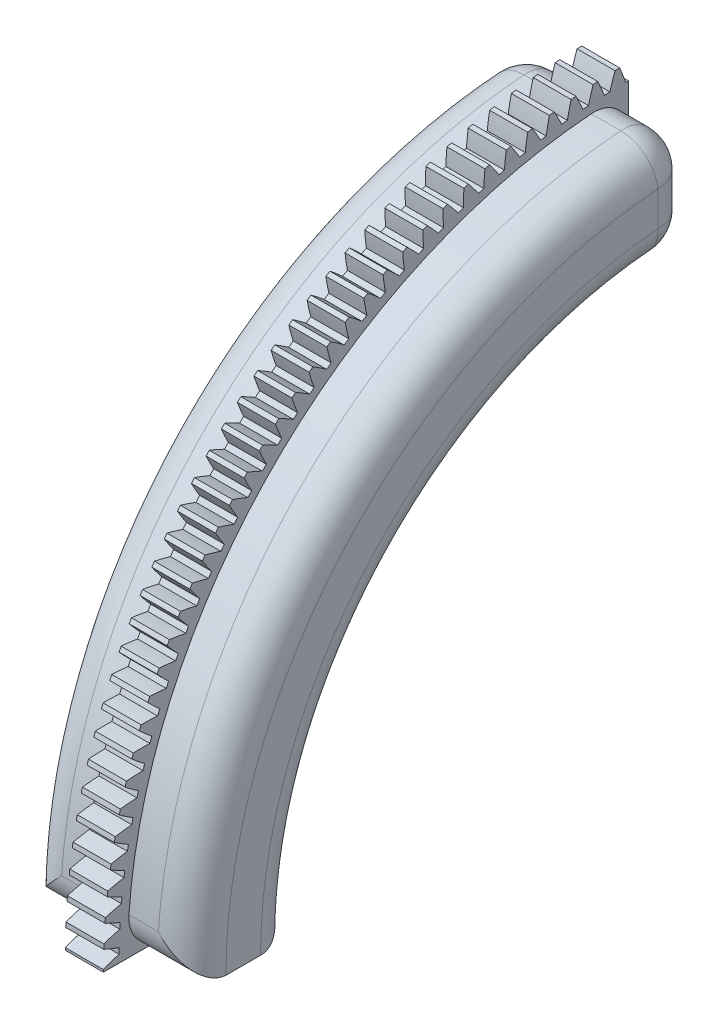
from build123d import *

# Parameters (mm, degrees)
BASPROSKE_W          = 5.5
BASPROSKE_H          = 76
TOOTHCUT_DEPTH       = 108.62086229
TEETHCUTS_COUNT      = 150
TEETHCUTS_ANGLE      = 357.6
BORSKE_R             = 4
BORE_DEPTH           = 50.0000508
CUT_EXTRUDE_1_DEPTH  = 108.613575976
EXTRUDE_1_DEPTH      = 12
EXTRUDE_1_DEPTH_BACK = 12
FILLET_1_R           = 5


with BuildPart() as part:
    # BasProSke → Base-Revolve (revolve)
    with BuildSketch(Plane(origin=(0, 0, 0), x_dir=(1, 0, 0), z_dir=(0, 1, 0))):
        with Locations((2.75, 38)):
            Rectangle(BASPROSKE_W, BASPROSKE_H)
    revolve(axis=Axis((-10, 0, 0), (1, 0, 0)))

    # TooCutSke → ToothCut (cut, through all)
    with BuildSketch(Plane(origin=(0, 0, 0), x_dir=(0, 0, -1), z_dir=(1, 0, 0))):
        with BuildLine():
            ThreePointArc((0.406703699, 73.747878567), (0, 73.749), (-0.406703699, 73.747878567))
            ThreePointArc((-0.406703699, 73.747878567), (-0.811952715, 74.890043248), (-1.263002313, 76.014908211))
            ThreePointArc((-1.263002313, 76.014908211), (0, 76.0254), (1.263002313, 76.014908211))
            ThreePointArc((1.263002313, 76.014908211), (0.811952715, 74.890043248), (0.406703699, 73.747878567))
        make_face()
    toothcut = extrude(amount=TOOTHCUT_DEPTH, mode=Mode.SUBTRACT)

    # TeethCuts: ToothCut ×150 about axis
    teethcuts_axis = Axis((-10, 0, 0), (1, 0, 0))
    for i in range(1, TEETHCUTS_COUNT):
        add(toothcut.rotate(teethcuts_axis, i * TEETHCUTS_ANGLE / (TEETHCUTS_COUNT - 1)), mode=Mode.SUBTRACT)

    # BorSke → Bore (cut, symmetric)
    with BuildSketch(Plane(origin=(0, 0, 0), x_dir=(0, 0, -1), z_dir=(1, 0, 0))):
        Circle(BORSKE_R)
    extrude(amount=BORE_DEPTH, both=True, mode=Mode.SUBTRACT)

    # ｽｹｯﾁ1 → ｶｯﾄ - 押し出し1 (cut, through all)
    with BuildSketch(Plane(origin=(5.5, 0, 0), x_dir=(0, 0, -1), z_dir=(1, 0, 0))):
        with BuildLine():
            Line((0, 100), (0, 72.5))
            ThreePointArc((0, 72.5), (-51.265241636, 51.265241636), (-72.5, 0))
            Line((-72.5, 0), (-100, 0))
            ThreePointArc((-100, 0), (70.710678119, -70.710678119), (0, 100))
        make_face()
    extrude(amount=-CUT_EXTRUDE_1_DEPTH, mode=Mode.SUBTRACT)

    # ｽｹｯﾁ2 → ﾎﾞｽ - 押し出し1 (add, two sides: drawn at the far end of the back side and taken through both)
    with BuildSketch(Plane(origin=(2.75, 0, 0), x_dir=(0, 0, -1), z_dir=(1, 0, 0)).offset(-EXTRUDE_1_DEPTH_BACK)):
        with BuildLine():
            Line((0, 72.5), (0, 57.5))
            ThreePointArc((0, 57.5), (-40.658639918, 40.658639918), (-57.5, 0))
            Line((-57.5, 0), (-72.5, 0))
            ThreePointArc((-72.5, 0), (-51.265241636, 51.265241636), (0, 72.5))
        make_face()
    extrude(amount=EXTRUDE_1_DEPTH + EXTRUDE_1_DEPTH_BACK)

    # ﾌｨﾚｯﾄ1
    fillet_1_edges = [part.edges().sort_by_distance(p)[0] for p in [
        (2.75, 57.5, 0),
        (-9.25, 65, 0),
        (14.75, 65, 0),
        (14.75, 51.265241636, 51.265241636),
        (14.75, 40.658639918, 40.658639918),
        (-9.25, 40.658639918, 40.658639918),
        (-9.25, 51.265241636, 51.265241636),
        (2.75, 0, 57.5),
        (10.125, 0, 72.5),
        (-4.625, 0, 72.5),
        (10.125, 72.5, 0),
        (-4.625, 72.5, 0),
    ]]
    fillet(fillet_1_edges, radius=FILLET_1_R)


solid = part.part
